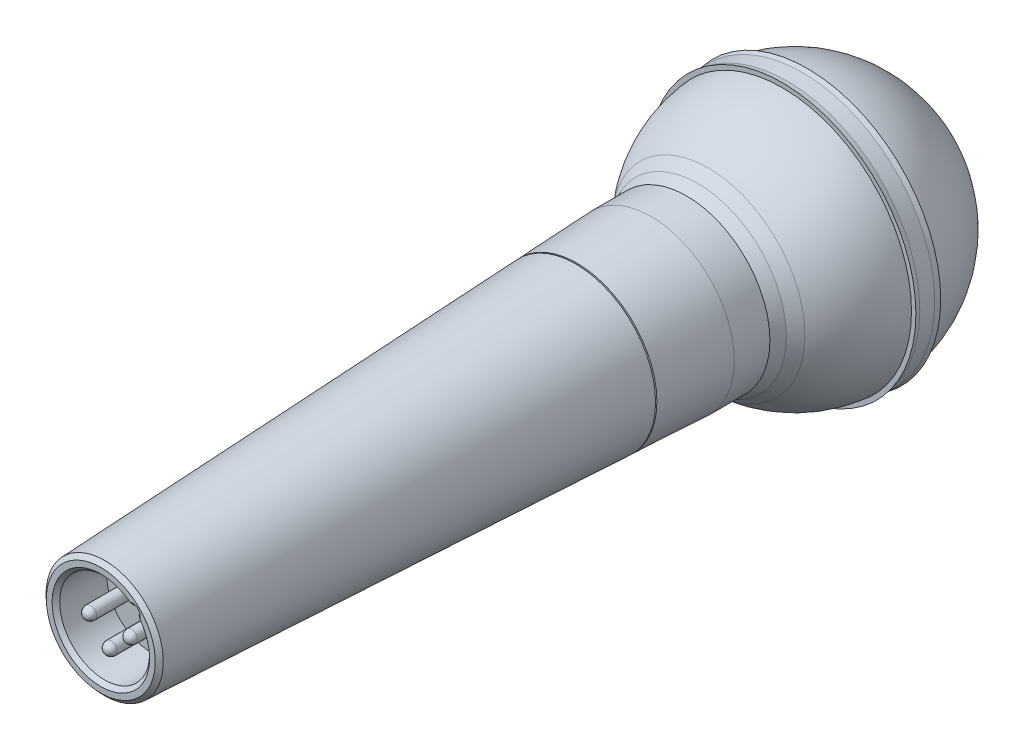
from build123d import *

# Parameters (mm, degrees)
CUT_EXTRUDE1_DEPTH      = 45.167295593
CUT_EXTRUDE1_DEPTH_BACK = 45.167295593
SKETCH4_R               = 8.838722385
CUT_EXTRUDE2_DEPTH      = 10
SKETCH5_R               = 1.2285
BOSS_EXTRUDE1_DEPTH     = 8
BOSS_EXTRUDE1_2_DEPTH   = 8
BOSS_EXTRUDE1_3_DEPTH   = 8
DOME1_FACE_RADIUS       = 1.2285
DOME1_HEIGHT            = 1.2285
DOME2_FACE_RADIUS       = 1.2285
DOME2_HEIGHT            = 1.2285
DOME3_FACE_RADIUS       = 1.2285
DOME3_HEIGHT            = 1.2285
SKETCH6_R               = 0.75
CUT_EXTRUDE4_DEPTH      = 10
CHAMFER1_SIZE           = 0.75
CHAMFER1_SIZE_2         = 0.786268666


with BuildPart() as part:
    # Sketch1 → Revolve2 (revolve)
    with BuildSketch(Plane(origin=(0, 0, 0), x_dir=(1, 0, 0), z_dir=(0, 1, 0))):
        with BuildLine():
            Line((0, 25.5), (0, -25.5))
            ThreePointArc((0, -25.5), (-25.5, 0), (0, 25.5))
        make_face()
    revolve(axis=Axis((0, 0, -25.5), (0, 0, 1)))

    # Sketch2 → Cut-Extrude1 (cut, two sides: drawn at the far end of the back side and taken through both)
    with BuildSketch(Plane(origin=(0, 0, 0), x_dir=(0, 0, -1), z_dir=(1, 0, 0)).offset(-CUT_EXTRUDE1_DEPTH_BACK)):
        with BuildLine():
            Line((-17, 19.006577809), (-17, -19.006577809))
            ThreePointArc((-17, -19.006577809), (-25.5, 0), (-17, 19.006577809))
        make_face()
    extrude(amount=CUT_EXTRUDE1_DEPTH + CUT_EXTRUDE1_DEPTH_BACK, mode=Mode.SUBTRACT)


with BuildPart() as body_2:
    # Sketch3 → Revolve4 (revolve)
    with BuildSketch(Plane(origin=(0, 0, 0), x_dir=(0, 0, -1), z_dir=(1, 0, 0)), mode=Mode.PRIVATE) as revolve4_sk:
        with BuildLine():
            Line((-25.5, 0), (-17, 0))
            Line((-17, 0), (-17, 19.006577809))
            ThreePointArc((-17, 19.006577809), (-23.278208694, 10.410331407), (-25.5, 0))
        make_face()
        with BuildLine():
            ThreePointArc((-25.5, 0), (-23.278208694, 10.410331407), (-17, 19.006577809))
            Line((-17, 19.006577809), (-19.054370862, 17.396557778))
            Line((-19.054370862, 17.396557778), (-21.278936425, 16.386785252))
            Line((-21.278936425, 16.386785252), (-28.278936425, 16.386785252))
            Line((-28.278936425, 16.386785252), (-42.85131589, 15.728760957))
            Line((-42.85131589, 15.728760957), (-42.85131589, 15.228760957))
            Line((-42.85131589, 15.228760957), (-43.10131589, 15.228760957))
            Line((-43.10131589, 15.228760957), (-43.10131589, 15.717472062))
            Line((-43.10131589, 15.717472062), (-136.5, 11.5))
            Line((-136.5, 11.5), (-136.5, 0))
            Line((-136.5, 0), (-25.5, 0))
        make_face()
        with BuildLine():
            ThreePointArc((2.451021145, 25.381932459), (0.012585798, 25.499996894), (-2.425964905, 25.384339548))
            Line((-2.425964905, 25.384339548), (-2.425964905, 26.252595455))
            Line((-2.425964905, 26.252595455), (-1.45421609, 26.045097289))
            Line((-1.45421609, 26.045097289), (1.479272331, 26.045097289))
            Line((1.479272331, 26.045097289), (2.451021145, 26.252595455))
            Line((2.451021145, 26.252595455), (2.451021145, 25.381932459))
        make_face()
    revolve(revolve4_sk.sketch.rotate(Axis((0, 0, 136.5), (0, 0, -1)), 90), axis=Axis((0, 0, 136.5), (0, 0, -1)))

    # Sketch4 → Cut-Extrude2 (cut)
    with BuildSketch(Plane.XY.offset(136.5)):
        Circle(SKETCH4_R)
    extrude(amount=-CUT_EXTRUDE2_DEPTH, mode=Mode.SUBTRACT)

    # Sketch6 → Cut-Extrude4 (cut)
    with BuildSketch(Plane.XY.offset(136.5)):
        with Locations((6.249920536, 6.249920536)):
            Circle(SKETCH6_R)
    extrude(amount=-CUT_EXTRUDE4_DEPTH, mode=Mode.SUBTRACT)

    # Chamfer1
    # the kernel refuses this chamfer: 0.786268666, 0.75 mm, written as the material it takes off along each edge
    with BuildSketch(Plane(origin=(0, 0, 136.5), x_dir=(0.7093247295722777, 0.7048818539423578, 0), z_dir=(-0.7048818539423578, 0.7093247295722777, 0))) as chamfer1_piece_1:
        Polygon((8.838722385 + CHAMFER1_SIZE, 0), (8.838722385, CHAMFER1_SIZE), (8.838722385, 0), align=None)
    revolve(axis=Axis((0, 0, 136.5), (0, 0, -1)), revolution_arc=359.64, mode=Mode.SUBTRACT)
    with BuildSketch(Plane(origin=(6.249920536, 6.249920536, 136.5), x_dir=(-0.7093247295722787, -0.7048818539423566, 0), z_dir=(0.7048818539423566, -0.7093247295722787, 0))) as chamfer1_piece_2:
        Polygon((0.75 + CHAMFER1_SIZE, 0), (0.75, CHAMFER1_SIZE), (0.75, 0), align=None)
    revolve(axis=Axis((6.249920536, 6.249920536, 136.5), (0, 0, -1)), revolution_arc=359.64, mode=Mode.SUBTRACT)
    with BuildSketch(Plane(origin=(0, 0, 136.5), x_dir=(1, 0, 0), z_dir=(0, 1, 0))) as chamfer1_piece_3:
        Polygon((11.5 + CHAMFER1_SIZE * 0.045109616875, CHAMFER1_SIZE * 0.998982043115), (11.5 - CHAMFER1_SIZE_2, 0), (11.5, 0), align=None)
    revolve(axis=Axis((0, 0, 136.5), (0, 0, -1)), mode=Mode.SUBTRACT)


with BuildPart() as body_3:
    # Sketch5 → Boss-Extrude1 (new body)
    with BuildSketch(Plane.XY.offset(126.5)):
        with Locations((-4.05003, 0)):
            Circle(SKETCH5_R)
    extrude(amount=BOSS_EXTRUDE1_DEPTH)

    # Dome1: a dome of height H over a round flat face of radius A is a cap of a sphere of radius (A * A + H * H) / (2 * H)
    dome1_r = (DOME1_FACE_RADIUS * DOME1_FACE_RADIUS + DOME1_HEIGHT * DOME1_HEIGHT) / (2 * DOME1_HEIGHT)
    dome1_base = Plane((-4.05003, 0, 134.5), z_dir=(0, 0, 1))
    with Locations(dome1_base.offset(DOME1_HEIGHT - dome1_r)):
        dome1_ball = Sphere(dome1_r, mode=Mode.PRIVATE)
    add(split(dome1_ball, bisect_by=dome1_base, keep=Keep.TOP, mode=Mode.PRIVATE))


with BuildPart() as body_4:
    # Sketch5 → Boss-Extrude1 2 (new body)
    with BuildSketch(Plane.XY.offset(126.5)):
        with Locations((4.05003, 0)):
            Circle(SKETCH5_R)
    extrude(amount=BOSS_EXTRUDE1_2_DEPTH)

    # Dome2: a dome of height H over a round flat face of radius A is a cap of a sphere of radius (A * A + H * H) / (2 * H)
    dome2_r = (DOME2_FACE_RADIUS * DOME2_FACE_RADIUS + DOME2_HEIGHT * DOME2_HEIGHT) / (2 * DOME2_HEIGHT)
    dome2_base = Plane((4.05003, 0, 134.5), z_dir=(0, 0, 1))
    with Locations(dome2_base.offset(DOME2_HEIGHT - dome2_r)):
        dome2_ball = Sphere(dome2_r, mode=Mode.PRIVATE)
    add(split(dome2_ball, bisect_by=dome2_base, keep=Keep.TOP, mode=Mode.PRIVATE))


with BuildPart() as body_5:
    # Sketch5 → Boss-Extrude1 3 (new body)
    with BuildSketch(Plane.XY.offset(126.5)):
        with Locations((0, -4.0005)):
            Circle(SKETCH5_R)
    extrude(amount=BOSS_EXTRUDE1_3_DEPTH)

    # Dome3: a dome of height H over a round flat face of radius A is a cap of a sphere of radius (A * A + H * H) / (2 * H)
    dome3_r = (DOME3_FACE_RADIUS * DOME3_FACE_RADIUS + DOME3_HEIGHT * DOME3_HEIGHT) / (2 * DOME3_HEIGHT)
    dome3_base = Plane((0, -4.0005, 134.5), z_dir=(0, 0, 1))
    with Locations(dome3_base.offset(DOME3_HEIGHT - dome3_r)):
        dome3_ball = Sphere(dome3_r, mode=Mode.PRIVATE)
    add(split(dome3_ball, bisect_by=dome3_base, keep=Keep.TOP, mode=Mode.PRIVATE))


solid = Compound([part.part, body_2.part, body_3.part, body_4.part, body_5.part])
